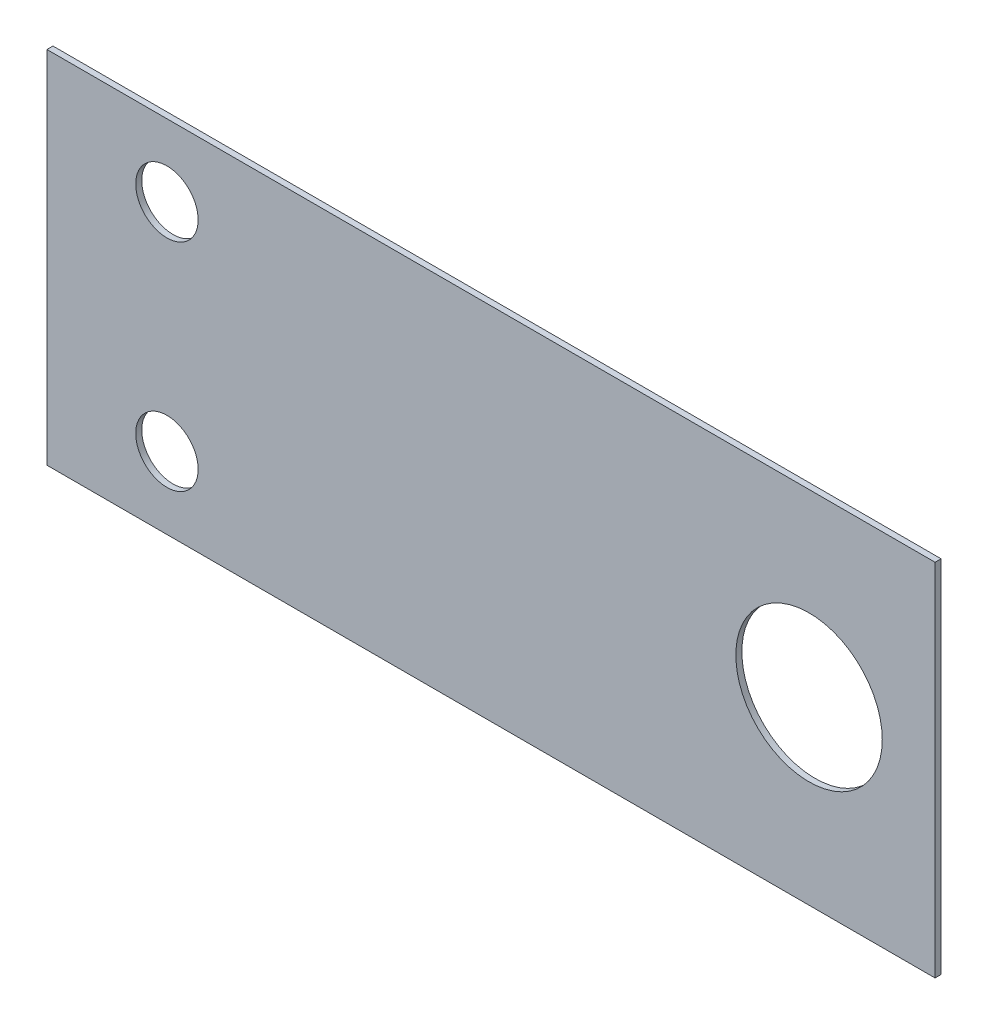
from build123d import *

# Parameters (mm, degrees)
SKETCH1_W                    = 74
SKETCH1_H                    = 30
BASE_FLANGE1_DEPTH           = 0.5
F_5_2_5_2_DIAMETER_HOLE1_D   = 5.2
F_12_2_12_2_DIAMETER_HOLE1_D = 12.2


# Sheet-metal steps are written as plain solids
with BuildPart() as part:
    # Sketch1 → Base-Flange1 (new body)
    with BuildSketch(Plane.XY):
        Rectangle(SKETCH1_W, SKETCH1_H)
    extrude(amount=BASE_FLANGE1_DEPTH)

    # Ø5.2 (5.2) Diameter Hole1 (through all)
    with Locations(Plane.XY.offset(0.5)):
        with Locations((-27, 9)):
            f_5_2_5_2_diameter_hole1 = Hole(F_5_2_5_2_DIAMETER_HOLE1_D / 2)

    # Mirror1: Ø5.2 (5.2) Diameter Hole1 across plane
    add(f_5_2_5_2_diameter_hole1.mirror(Plane.ZX), mode=Mode.SUBTRACT)

    # Ø12.2 (12.2) Diameter Hole1 (through all)
    with Locations(Plane.XY.offset(0.5)):
        with Locations((26.5, 0)):
            Hole(F_12_2_12_2_DIAMETER_HOLE1_D / 2)


solid = part.part
